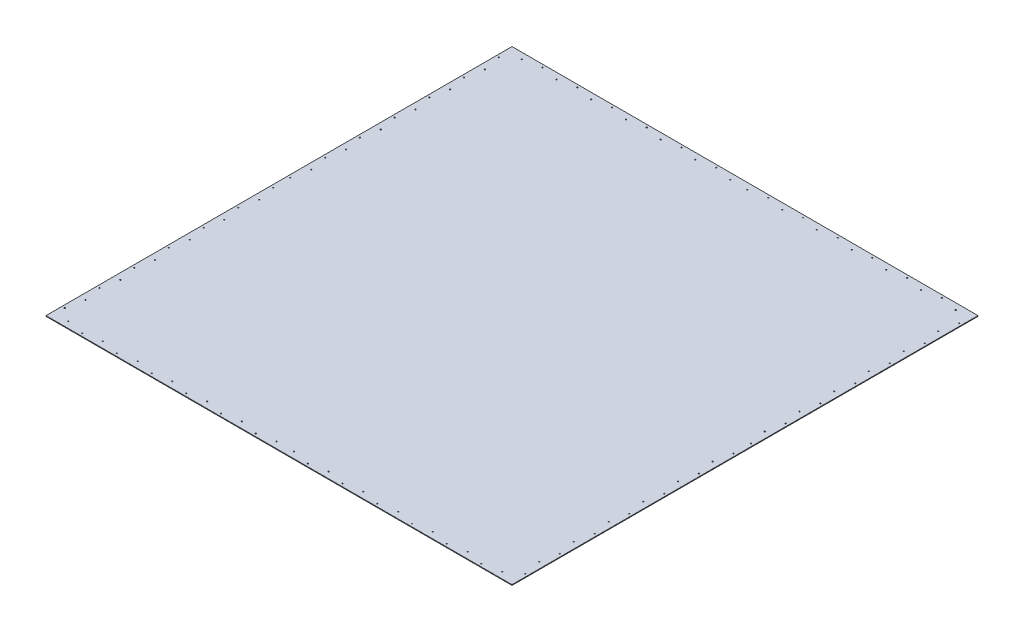
from build123d import *

# Parameters (mm, degrees)
SKETCH1_W                = 1342
SKETCH1_H                = 1342
BOSS_EXTRUDE1_DEPTH      = 2
SKETCH2_R                = 1.5
CUT_EXTRUDE1_DEPTH       = 2
CHAMFER2_SIZE            = 1.8
CHAMFER2_OF_MIRROR1_SIZE = 1.8
SKETCH3_R                = 1.5
CUT_EXTRUDE2_DEPTH       = 2
CHAMFER3_SIZE            = 1.8
CHAMFER3_OF_MIRROR2_SIZE = 1.8


# Read off the part's stored shape, not the designer's step: LPattern1, LPattern2, Mirror3
with BuildPart() as part:
    # Sketch1 → Boss-Extrude1 (new body)
    with BuildSketch(Plane(origin=(0, 0, 0), x_dir=(1, 0, 0), z_dir=(0, 1, 0))):
        Rectangle(SKETCH1_W, SKETCH1_H)
    extrude(amount=BOSS_EXTRUDE1_DEPTH)

    # Sketch2 → Cut-Extrude1 (cut)
    with BuildSketch(Plane(origin=(0, 2, 0), x_dir=(1, 0, 0), z_dir=(0, 1, 0))):
        with Locations(Location((-663, 25, 0), (0, 0, 270))):
            Circle(SKETCH2_R)
        with Locations(Location((-653, 75, 0), (0, 0, 270))):
            Circle(SKETCH2_R)
    cut_extrude1 = extrude(amount=-CUT_EXTRUDE1_DEPTH, mode=Mode.SUBTRACT)

    # Chamfer2
    chamfer2_edges = [part.edges().sort_by_distance(p)[0] for p in [
        (-663, 0, -26.5),
        (-653, 0, -76.5),
    ]]
    chamfer(chamfer2_edges, length=CHAMFER2_SIZE)

    # LPattern1 outline → LPattern1 (revolve, cut)
    with BuildSketch(Plane(origin=(-663, 0, -125), x_dir=(1, 0, 0), z_dir=(0, 0, 1))):
        Polygon((0, 0), (3.3, 0), (1.5, 1.8), (1.5, 2), (0, 2), align=None)
    lpattern1 = revolve(axis=Axis((-663, 0, -125), (0, 1, 0)), mode=Mode.SUBTRACT)

    # LPattern1 2 outline → LPattern1 2 (revolve, cut)
    with BuildSketch(Plane(origin=(-663, 0, -625), x_dir=(1, 0, 0), z_dir=(0, 0, 1))):
        Polygon((0, 0), (3.3, 0), (1.5, 1.8), (1.5, 2), (0, 2), align=None)
    lpattern1_2 = revolve(axis=Axis((-663, 0, -625), (0, 1, 0)), mode=Mode.SUBTRACT)

    # LPattern1 3 outline → LPattern1 3 (revolve, cut)
    with BuildSketch(Plane(origin=(-663, 0, -525), x_dir=(1, 0, 0), z_dir=(0, 0, 1))):
        Polygon((0, 0), (3.3, 0), (1.5, 1.8), (1.5, 2), (0, 2), align=None)
    lpattern1_3 = revolve(axis=Axis((-663, 0, -525), (0, 1, 0)), mode=Mode.SUBTRACT)

    # LPattern1 4 outline → LPattern1 4 (revolve, cut)
    with BuildSketch(Plane(origin=(-663, 0, -425), x_dir=(1, 0, 0), z_dir=(0, 0, 1))):
        Polygon((0, 0), (3.3, 0), (1.5, 1.8), (1.5, 2), (0, 2), align=None)
    lpattern1_4 = revolve(axis=Axis((-663, 0, -425), (0, 1, 0)), mode=Mode.SUBTRACT)

    # LPattern1 5 outline → LPattern1 5 (revolve, cut)
    with BuildSketch(Plane(origin=(-663, 0, -325), x_dir=(1, 0, 0), z_dir=(0, 0, 1))):
        Polygon((0, 0), (3.3, 0), (1.5, 1.8), (1.5, 2), (0, 2), align=None)
    lpattern1_5 = revolve(axis=Axis((-663, 0, -325), (0, 1, 0)), mode=Mode.SUBTRACT)

    # LPattern1 6 outline → LPattern1 6 (revolve, cut)
    with BuildSketch(Plane(origin=(-663, 0, -225), x_dir=(1, 0, 0), z_dir=(0, 0, 1))):
        Polygon((0, 0), (3.3, 0), (1.5, 1.8), (1.5, 2), (0, 2), align=None)
    lpattern1_6 = revolve(axis=Axis((-663, 0, -225), (0, 1, 0)), mode=Mode.SUBTRACT)

    # LPattern1 7 outline → LPattern1 7 (revolve, cut)
    with BuildSketch(Plane(origin=(-653, 0, -175), x_dir=(1, 0, 0), z_dir=(0, 0, 1))):
        Polygon((0, 0), (3.3, 0), (1.5, 1.8), (1.5, 2), (0, 2), align=None)
    lpattern1_7 = revolve(axis=Axis((-653, 0, -175), (0, 1, 0)), mode=Mode.SUBTRACT)

    # LPattern1 8 outline → LPattern1 8 (revolve, cut)
    with BuildSketch(Plane(origin=(-653, 0, -575), x_dir=(1, 0, 0), z_dir=(0, 0, 1))):
        Polygon((0, 0), (3.3, 0), (1.5, 1.8), (1.5, 2), (0, 2), align=None)
    lpattern1_8 = revolve(axis=Axis((-653, 0, -575), (0, 1, 0)), mode=Mode.SUBTRACT)

    # LPattern1 9 outline → LPattern1 9 (revolve, cut)
    with BuildSketch(Plane(origin=(-653, 0, -475), x_dir=(1, 0, 0), z_dir=(0, 0, 1))):
        Polygon((0, 0), (3.3, 0), (1.5, 1.8), (1.5, 2), (0, 2), align=None)
    lpattern1_9 = revolve(axis=Axis((-653, 0, -475), (0, 1, 0)), mode=Mode.SUBTRACT)

    # LPattern1 10 outline → LPattern1 10 (revolve, cut)
    with BuildSketch(Plane(origin=(-653, 0, -375), x_dir=(1, 0, 0), z_dir=(0, 0, 1))):
        Polygon((0, 0), (3.3, 0), (1.5, 1.8), (1.5, 2), (0, 2), align=None)
    lpattern1_10 = revolve(axis=Axis((-653, 0, -375), (0, 1, 0)), mode=Mode.SUBTRACT)

    # LPattern1 11 outline → LPattern1 11 (revolve, cut)
    with BuildSketch(Plane(origin=(-653, 0, -275), x_dir=(1, 0, 0), z_dir=(0, 0, 1))):
        Polygon((0, 0), (3.3, 0), (1.5, 1.8), (1.5, 2), (0, 2), align=None)
    lpattern1_11 = revolve(axis=Axis((-653, 0, -275), (0, 1, 0)), mode=Mode.SUBTRACT)

    # Mirror1: Cut-Extrude1, LPattern1, LPattern1 2, LPattern1 3, LPattern1 4, LPattern1 5, LPattern1 6, LPattern1 7, LPattern1 8, LPattern1 9, LPattern1 10, LPattern1 11 across plane
    add(cut_extrude1.mirror(Plane.XY), mode=Mode.SUBTRACT)
    add(lpattern1.mirror(Plane.XY), mode=Mode.SUBTRACT)
    add(lpattern1_2.mirror(Plane.XY), mode=Mode.SUBTRACT)
    add(lpattern1_3.mirror(Plane.XY), mode=Mode.SUBTRACT)
    add(lpattern1_4.mirror(Plane.XY), mode=Mode.SUBTRACT)
    add(lpattern1_5.mirror(Plane.XY), mode=Mode.SUBTRACT)
    add(lpattern1_6.mirror(Plane.XY), mode=Mode.SUBTRACT)
    add(lpattern1_7.mirror(Plane.XY), mode=Mode.SUBTRACT)
    add(lpattern1_8.mirror(Plane.XY), mode=Mode.SUBTRACT)
    add(lpattern1_9.mirror(Plane.XY), mode=Mode.SUBTRACT)
    add(lpattern1_10.mirror(Plane.XY), mode=Mode.SUBTRACT)
    add(lpattern1_11.mirror(Plane.XY), mode=Mode.SUBTRACT)

    # Chamfer2 of Mirror1
    chamfer2_of_mirror1_edges = [part.edges().sort_by_distance(p)[0] for p in [
        (-663, 0, 26.5),
        (-653, 0, 76.5),
    ]]
    chamfer(chamfer2_of_mirror1_edges, length=CHAMFER2_OF_MIRROR1_SIZE)

    # Sketch3 → Cut-Extrude2 (cut)
    with BuildSketch(Plane(origin=(0, 2, 0), x_dir=(1, 0, 0), z_dir=(0, 1, 0))):
        with Locations(Location((-25, 653, 0), (0, 0, 270))):
            Circle(SKETCH3_R)
        with Locations(Location((-75, 663, 0), (0, 0, 270))):
            Circle(SKETCH3_R)
    cut_extrude2 = extrude(amount=-CUT_EXTRUDE2_DEPTH, mode=Mode.SUBTRACT)

    # Chamfer3
    chamfer3_edges = [part.edges().sort_by_distance(p)[0] for p in [
        (-75, 0, -664.5),
        (-25, 0, -654.5),
    ]]
    chamfer(chamfer3_edges, length=CHAMFER3_SIZE)

    # LPattern2 outline → LPattern2 (revolve, cut)
    with BuildSketch(Plane(origin=(-125, 0, -653), x_dir=(1, 0, 0), z_dir=(0, 0, 1))):
        Polygon((0, 0), (3.3, 0), (1.5, 1.8), (1.5, 2), (0, 2), align=None)
    lpattern2 = revolve(axis=Axis((-125, 0, -653), (0, 1, 0)), mode=Mode.SUBTRACT)

    # LPattern2 2 outline → LPattern2 2 (revolve, cut)
    with BuildSketch(Plane(origin=(-625, 0, -653), x_dir=(1, 0, 0), z_dir=(0, 0, 1))):
        Polygon((0, 0), (3.3, 0), (1.5, 1.8), (1.5, 2), (0, 2), align=None)
    lpattern2_2 = revolve(axis=Axis((-625, 0, -653), (0, 1, 0)), mode=Mode.SUBTRACT)

    # LPattern2 3 outline → LPattern2 3 (revolve, cut)
    with BuildSketch(Plane(origin=(-525, 0, -653), x_dir=(1, 0, 0), z_dir=(0, 0, 1))):
        Polygon((0, 0), (3.3, 0), (1.5, 1.8), (1.5, 2), (0, 2), align=None)
    lpattern2_3 = revolve(axis=Axis((-525, 0, -653), (0, 1, 0)), mode=Mode.SUBTRACT)

    # LPattern2 4 outline → LPattern2 4 (revolve, cut)
    with BuildSketch(Plane(origin=(-425, 0, -653), x_dir=(1, 0, 0), z_dir=(0, 0, 1))):
        Polygon((0, 0), (3.3, 0), (1.5, 1.8), (1.5, 2), (0, 2), align=None)
    lpattern2_4 = revolve(axis=Axis((-425, 0, -653), (0, 1, 0)), mode=Mode.SUBTRACT)

    # LPattern2 5 outline → LPattern2 5 (revolve, cut)
    with BuildSketch(Plane(origin=(-325, 0, -653), x_dir=(1, 0, 0), z_dir=(0, 0, 1))):
        Polygon((0, 0), (3.3, 0), (1.5, 1.8), (1.5, 2), (0, 2), align=None)
    lpattern2_5 = revolve(axis=Axis((-325, 0, -653), (0, 1, 0)), mode=Mode.SUBTRACT)

    # LPattern2 6 outline → LPattern2 6 (revolve, cut)
    with BuildSketch(Plane(origin=(-225, 0, -653), x_dir=(1, 0, 0), z_dir=(0, 0, 1))):
        Polygon((0, 0), (3.3, 0), (1.5, 1.8), (1.5, 2), (0, 2), align=None)
    lpattern2_6 = revolve(axis=Axis((-225, 0, -653), (0, 1, 0)), mode=Mode.SUBTRACT)

    # LPattern2 7 outline → LPattern2 7 (revolve, cut)
    with BuildSketch(Plane(origin=(-175, 0, -663), x_dir=(1, 0, 0), z_dir=(0, 0, 1))):
        Polygon((0, 0), (3.3, 0), (1.5, 1.8), (1.5, 2), (0, 2), align=None)
    lpattern2_7 = revolve(axis=Axis((-175, 0, -663), (0, 1, 0)), mode=Mode.SUBTRACT)

    # LPattern2 8 outline → LPattern2 8 (revolve, cut)
    with BuildSketch(Plane(origin=(-575, 0, -663), x_dir=(1, 0, 0), z_dir=(0, 0, 1))):
        Polygon((0, 0), (3.3, 0), (1.5, 1.8), (1.5, 2), (0, 2), align=None)
    lpattern2_8 = revolve(axis=Axis((-575, 0, -663), (0, 1, 0)), mode=Mode.SUBTRACT)

    # LPattern2 9 outline → LPattern2 9 (revolve, cut)
    with BuildSketch(Plane(origin=(-475, 0, -663), x_dir=(1, 0, 0), z_dir=(0, 0, 1))):
        Polygon((0, 0), (3.3, 0), (1.5, 1.8), (1.5, 2), (0, 2), align=None)
    lpattern2_9 = revolve(axis=Axis((-475, 0, -663), (0, 1, 0)), mode=Mode.SUBTRACT)

    # LPattern2 10 outline → LPattern2 10 (revolve, cut)
    with BuildSketch(Plane(origin=(-375, 0, -663), x_dir=(1, 0, 0), z_dir=(0, 0, 1))):
        Polygon((0, 0), (3.3, 0), (1.5, 1.8), (1.5, 2), (0, 2), align=None)
    lpattern2_10 = revolve(axis=Axis((-375, 0, -663), (0, 1, 0)), mode=Mode.SUBTRACT)

    # LPattern2 11 outline → LPattern2 11 (revolve, cut)
    with BuildSketch(Plane(origin=(-275, 0, -663), x_dir=(1, 0, 0), z_dir=(0, 0, 1))):
        Polygon((0, 0), (3.3, 0), (1.5, 1.8), (1.5, 2), (0, 2), align=None)
    lpattern2_11 = revolve(axis=Axis((-275, 0, -663), (0, 1, 0)), mode=Mode.SUBTRACT)

    # Mirror2: Cut-Extrude2, LPattern2, LPattern2 2, LPattern2 3, LPattern2 4, LPattern2 5, LPattern2 6, LPattern2 7, LPattern2 8, LPattern2 9, LPattern2 10, LPattern2 11 across plane
    add(cut_extrude2.mirror(Plane.XY), mode=Mode.SUBTRACT)
    add(lpattern2.mirror(Plane.XY), mode=Mode.SUBTRACT)
    add(lpattern2_2.mirror(Plane.XY), mode=Mode.SUBTRACT)
    add(lpattern2_3.mirror(Plane.XY), mode=Mode.SUBTRACT)
    add(lpattern2_4.mirror(Plane.XY), mode=Mode.SUBTRACT)
    add(lpattern2_5.mirror(Plane.XY), mode=Mode.SUBTRACT)
    add(lpattern2_6.mirror(Plane.XY), mode=Mode.SUBTRACT)
    add(lpattern2_7.mirror(Plane.XY), mode=Mode.SUBTRACT)
    add(lpattern2_8.mirror(Plane.XY), mode=Mode.SUBTRACT)
    add(lpattern2_9.mirror(Plane.XY), mode=Mode.SUBTRACT)
    add(lpattern2_10.mirror(Plane.XY), mode=Mode.SUBTRACT)
    add(lpattern2_11.mirror(Plane.XY), mode=Mode.SUBTRACT)

    # Chamfer3 of Mirror2
    chamfer3_of_mirror2_edges = [part.edges().sort_by_distance(p)[0] for p in [
        (-75, 0, 664.5),
        (-25, 0, 654.5),
    ]]
    chamfer(chamfer3_of_mirror2_edges, length=CHAMFER3_OF_MIRROR2_SIZE)

    # Mirror3
    split(bisect_by=Plane(origin=(0, 0, 0), x_dir=(0, 0, 1), z_dir=(1, 0, 0)), keep=Keep.BOTTOM)

    # Mirror3 2: part across plane


with BuildPart() as part_1:
    add(part.part)
    add(part.part.mirror(Plane(origin=(0, 0, 0), x_dir=(0, 0, 1), z_dir=(1, 0, 0))))


solid = part_1.part
